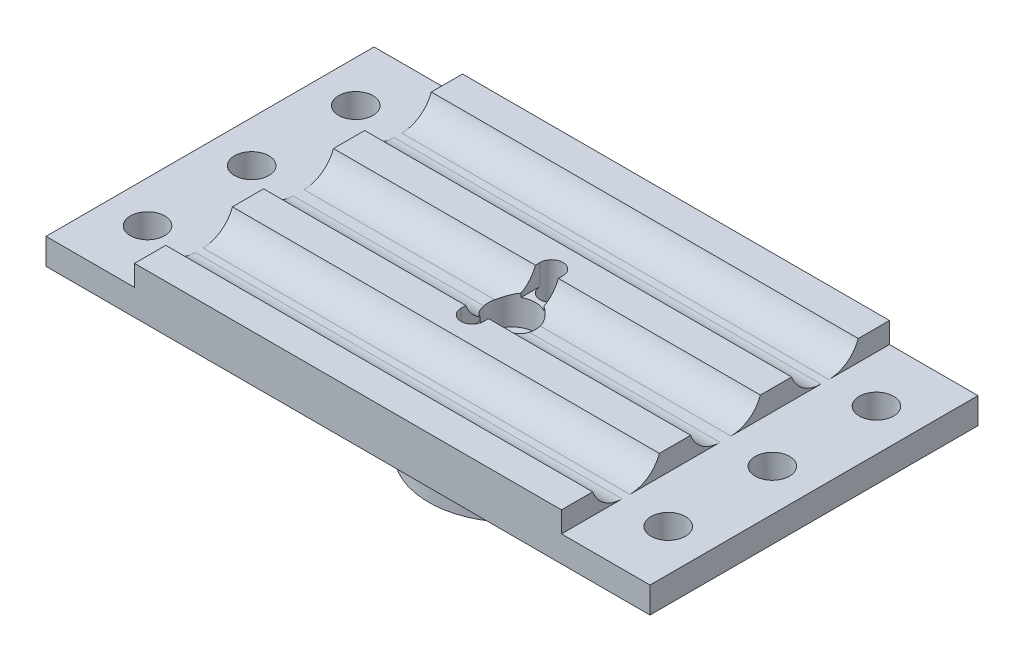
from build123d import *

# Parameters (mm, degrees)
SKETCH_1_R               = 50
EXTRUDE_1_DEPTH          = 2.5
SKETCH_2_R               = 8
EXTRUDE_2_DEPTH          = 9
SKETCH_3_R               = 6.1
CUT_EXTRUDE_1_DEPTH      = 2
CUT_EXTRUDE_2_DEPTH      = 5
SKETCH_7_R               = 1.15
CUT_EXTRUDE_4_DEPTH      = 4.5
SKETCH_8_R               = 2.25
CUT_EXTRUDE_5_DEPTH      = 2.5
CUT_EXTRUDE_6_DEPTH      = 72.281133549
CUT_EXTRUDE_6_DEPTH_BACK = 72.281133549
SKETCH_11_R              = 1.1
SKETCH_14_R              = 1.65
CUT_EXTRUDE_7_DEPTH      = 2.5
CUT_EXTRUDE_START        = -2.5
SKETCH_15_R              = 50
SKETCH_15_W              = 58
SKETCH_15_H              = 31.5
CUT_EXTRUDE_8_DEPTH      = 2.5
SKETCH_16_W              = 41
SKETCH_16_H              = 3
EXTRUDE_4_DEPTH          = 2
CUT_EXTRUDE_9_DEPTH      = 2
FILLET_3_R               = 3


with BuildPart() as part:
    # Эскиз1 → Бобышка-Вытянуть1 (new body)
    with BuildSketch(Plane(origin=(0, 0, 0), x_dir=(1, 0, 0), z_dir=(0, 1, 0))):
        with Locations(Location((0, 0, 0), (0, 0, 270))):
            Circle(SKETCH_1_R)
    extrude(amount=EXTRUDE_1_DEPTH)

    # Эскиз2 → Бобышка-Вытянуть2 (add)
    with BuildSketch(Plane.XZ):
        with Locations(Location((0, 0, 0), (0, 0, 270))):
            Circle(SKETCH_2_R)
    extrude(amount=EXTRUDE_2_DEPTH)

    # Эскиз3 → Вырез-Вытянуть1 (cut)
    with BuildSketch(Plane.XZ.offset(9)):
        with Locations(Location((0, 0, 0), (0, 0, 270))):
            Circle(SKETCH_3_R)
    extrude(amount=-CUT_EXTRUDE_1_DEPTH, mode=Mode.SUBTRACT)

    # Эскиз4 → Вырез-Вытянуть2 (cut)
    with BuildSketch(Plane.XZ.offset(7)):
        with BuildLine():
            Line((-3.1, 5.253570215), (-3.1, -5.253570215))
            ThreePointArc((-3.1, -5.253570215), (0, -6.1), (3.1, -5.253570215))
            Line((3.1, -5.253570215), (3.1, 5.253570215))
            ThreePointArc((3.1, 5.253570215), (0, 6.1), (-3.1, 5.253570215))
        make_face()
    extrude(amount=-CUT_EXTRUDE_2_DEPTH, mode=Mode.SUBTRACT)

    # Эскиз7 → Вырез-Вытянуть4 (cut)
    with BuildSketch(Plane(origin=(0, 2.5, 0), x_dir=(1, 0, 0), z_dir=(0, 1, 0))):
        with Locations(Location((0, 0, 0), (0, 0, 270))):
            Circle(SKETCH_7_R)
    extrude(amount=-CUT_EXTRUDE_4_DEPTH, mode=Mode.SUBTRACT)

    # Эскиз8 → Вырез-Вытянуть5 (cut)
    with BuildSketch(Plane(origin=(0, 2.5, 0), x_dir=(1, 0, 0), z_dir=(0, 1, 0))):
        with Locations(Location((0, 0, 0), (0, 0, 270))):
            Circle(SKETCH_8_R)
    extrude(amount=-CUT_EXTRUDE_5_DEPTH, mode=Mode.SUBTRACT)

    # Эскиз11 → Вырез-Вытянуть6 (cut, two sides: drawn at the far end of the back side and taken through both)
    with BuildSketch(Plane.XZ.offset(-CUT_EXTRUDE_6_DEPTH_BACK)):
        with Locations(Location((0, 3.8, 0), (0, 0, 270))):
            Circle(SKETCH_11_R)
        with Locations(Location((0, -3.8, 0), (0, 0, 90))):
            Circle(SKETCH_11_R)
    extrude(amount=CUT_EXTRUDE_6_DEPTH + CUT_EXTRUDE_6_DEPTH_BACK, mode=Mode.SUBTRACT)

    # Эскиз14 → Вырез-Вытянуть7 (cut)
    with BuildSketch(Plane(origin=(0, 2.5, 0), x_dir=(1, 0, 0), z_dir=(0, 1, 0))):
        with Locations(Location((-25, 0, 0), (0, 0, 270))):
            Circle(SKETCH_14_R)
        with Locations(Location((-25, 10, 0), (0, 0, 270))):
            Circle(SKETCH_14_R)
        with Locations(Location((-25, -10, 0), (0, 0, 270))):
            Circle(SKETCH_14_R)
        with Locations(Location((25, -10, 0), (0, 0, 270))):
            Circle(SKETCH_14_R)
        with Locations(Location((25, 0, 0), (0, 0, 270))):
            Circle(SKETCH_14_R)
        with Locations(Location((25, 10, 0), (0, 0, 270))):
            Circle(SKETCH_14_R)
    extrude(amount=-CUT_EXTRUDE_7_DEPTH, mode=Mode.SUBTRACT)

    # Эскиз15 → Вырез-Вытянуть8 (cut)
    with BuildSketch(Plane(origin=(0, 2.5, 0), x_dir=(1, 0, 0), z_dir=(0, 1, 0)).offset(CUT_EXTRUDE_START)):
        Circle(SKETCH_15_R)
        Rectangle(SKETCH_15_W, SKETCH_15_H, mode=Mode.SUBTRACT)
    extrude(amount=CUT_EXTRUDE_8_DEPTH, mode=Mode.SUBTRACT)

    # Эскиз16 → Бобышка-Вытянуть4 (add)
    with BuildSketch(Plane(origin=(0, 2.5, 0), x_dir=(1, 0, 0), z_dir=(0, 1, 0))):
        with Locations((0, 14.25)):
            Rectangle(SKETCH_16_W, SKETCH_16_H)
        with Locations((0, 4.85)):
            Rectangle(SKETCH_16_W, SKETCH_16_H)
        with Locations((0, -4.85)):
            Rectangle(SKETCH_16_W, SKETCH_16_H)
        with Locations((0, -14.25)):
            Rectangle(SKETCH_16_W, SKETCH_16_H)
    extrude(amount=EXTRUDE_4_DEPTH)

    # Эскиз17 → Вырез-Вытянуть9 (cut)
    with BuildSketch(Plane(origin=(0, 2.5, 0), x_dir=(1, 0, 0), z_dir=(0, 1, 0))):
        with BuildLine():
            Line((-1.1, 3.8), (-1.1, 2.7))
            Line((-1.1, 2.7), (1.1, 2.7))
            Line((1.1, 2.7), (1.1, 3.8))
            ThreePointArc((1.1, 3.8), (0, 4.9), (-1.1, 3.8))
        make_face()
        with BuildLine():
            Line((-1.1, -3.8), (-1.1, -2.7))
            Line((-1.1, -2.7), (1.1, -2.7))
            Line((1.1, -2.7), (1.1, -3.8))
            ThreePointArc((1.1, -3.8), (0, -4.9), (-1.1, -3.8))
        make_face()
    extrude(amount=CUT_EXTRUDE_9_DEPTH, mode=Mode.SUBTRACT)

    # Скругление3
    # the kernel refuses this fillet: 3 mm, written as the material it adds along each edge
    with BuildSketch(Plane(origin=(20.5, 2.5, 12.75), x_dir=(0, 0, -1), z_dir=(-1, 0, 0)), Plane(origin=(-20.5, 2.5, 6.35), x_dir=(0, 0, 1), z_dir=(1, 0, 0))) as fillet_3_piece_1:
        with BuildLine():
            CenterArc((2.828427125, -3), FILLET_3_R, 90, 70.528779366)
            Line((0, -2), (-0.056568542, -1.98))
            ThreePointArc((-0.056568542, -1.98), (-0.06, -1), (-0.06, 0))
            Line((-0.06, 0), (0, 0.06))
            Line((0, 0.06), (2.828427125, 0.06))
            Line((2.828427125, 0.06), (2.828427125, 0))
        make_face()
    extrude(amount=41)
    with BuildSketch(Plane(origin=(20.5, 2.5, 3.35), x_dir=(0, 0, -1), z_dir=(-1, 0, 0))) as fillet_3_piece_2_section:
        with BuildLine():
            CenterArc((2.828427125, -3), FILLET_3_R, 90, 70.528779366)
            Line((0, -2), (-0.056568542, -1.98))
            ThreePointArc((-0.056568542, -1.98), (-0.06, -1), (-0.06, 0))
            Line((-0.06, 0), (0, 0.06))
            Line((0, 0.06), (2.828427125, 0.06))
            Line((2.828427125, 0.06), (2.828427125, 0))
        make_face()
    fillet_3_piece_2 = extrude(amount=19.4, mode=Mode.PRIVATE)
    fillet_3_piece_2 = fillet_3_piece_2 - Plane(origin=(0, 3.015381172, 0), x_dir=(0, 0, 1), z_dir=(0, 1, 0)) * Cylinder(2.25, 51, mode=Mode.PRIVATE)
    add(fillet_3_piece_2)
    with BuildSketch(Plane(origin=(20.5, 2.5, 3.35), x_dir=(0, 0, -1), z_dir=(-1, 0, 0))) as fillet_3_piece_3_section:
        with BuildLine():
            CenterArc((2.828427125, -3), FILLET_3_R, 90, 70.528779366)
            Line((0, -2), (-0.056568542, -1.98))
            ThreePointArc((-0.056568542, -1.98), (-0.06, -1), (-0.06, 0))
            Line((-0.06, 0), (0, 0.06))
            Line((0, 0.06), (2.828427125, 0.06))
            Line((2.828427125, 0.06), (2.828427125, 0))
        make_face()
    fillet_3_piece_3 = extrude(amount=26.471067812, mode=Mode.PRIVATE)
    fillet_3_piece_3 = fillet_3_piece_3 - Plane(origin=(0, 3.020982336, 0), x_dir=(0, 0, 1), z_dir=(0, 1, 0)) * Cylinder(2.25, 65, mode=Mode.PRIVATE)
    fillet_3_piece_3 = split(fillet_3_piece_3, bisect_by=Plane(origin=(-1.1, 3.020982336, 2.69327095), z_dir=(-1, 0, 0)), keep=Keep.TOP, mode=Mode.PRIVATE)
    add(fillet_3_piece_3)
    with BuildSketch(Plane(origin=(5.971067812, 2.5, 3.35), x_dir=(0, 0, -1), z_dir=(-1, 0, 0))) as fillet_3_piece_4_section:
        with BuildLine():
            CenterArc((2.828427125, -3), FILLET_3_R, 90, 70.528779366)
            Line((0, -2), (-0.056568542, -1.98))
            ThreePointArc((-0.056568542, -1.98), (-0.06, -1), (-0.06, 0))
            Line((-0.06, 0), (0, 0.06))
            Line((0, 0.06), (2.828427125, 0.06))
            Line((2.828427125, 0.06), (2.828427125, 0))
        make_face()
    fillet_3_piece_4 = extrude(amount=26.471067812, mode=Mode.PRIVATE)
    fillet_3_piece_4 = fillet_3_piece_4 - Plane(origin=(0, 3.020982326, 0), x_dir=(0, 0, 1), z_dir=(0, 1, 0)) * Cylinder(2.25, 65, mode=Mode.PRIVATE)
    fillet_3_piece_4 = split(fillet_3_piece_4, bisect_by=Plane(origin=(1.1, 3.020982326, 2.69327092), z_dir=(1, 0, 0)), keep=Keep.TOP, mode=Mode.PRIVATE)
    add(fillet_3_piece_4)
    with BuildSketch(Plane(origin=(-1.1, 2.5, 3.35), x_dir=(0, 0, -1), z_dir=(-1, 0, 0))) as fillet_3_piece_5_section:
        with BuildLine():
            CenterArc((2.828427125, -3), FILLET_3_R, 90, 70.528779366)
            Line((0, -2), (-0.056568542, -1.98))
            ThreePointArc((-0.056568542, -1.98), (-0.06, -1), (-0.06, 0))
            Line((-0.06, 0), (0, 0.06))
            Line((0, 0.06), (2.828427125, 0.06))
            Line((2.828427125, 0.06), (2.828427125, 0))
        make_face()
    fillet_3_piece_5 = extrude(amount=19.4, mode=Mode.PRIVATE)
    fillet_3_piece_5 = fillet_3_piece_5 - Plane(origin=(0, 3.015381179, 0), x_dir=(0, 0, 1), z_dir=(0, 1, 0)) * Cylinder(2.25, 51, mode=Mode.PRIVATE)
    add(fillet_3_piece_5)
    with BuildSketch(Plane(origin=(5.971067812, 2.5, -3.35), x_dir=(0, 0, 1), z_dir=(-1, 0, 0))) as fillet_3_piece_6_section:
        with BuildLine():
            CenterArc((2.828427125, 3), FILLET_3_R, 199.471220634, 70.528779366)
            Line((0, 2), (-0.056568542, 1.98))
            ThreePointArc((-0.056568542, 1.98), (-0.06, 1), (-0.06, 0))
            Line((-0.06, 0), (0, -0.06))
            Line((0, -0.06), (2.828427125, -0.06))
            Line((2.828427125, -0.06), (2.828427125, 0))
        make_face()
    fillet_3_piece_6 = extrude(amount=26.471067812, mode=Mode.PRIVATE)
    fillet_3_piece_6 = fillet_3_piece_6 - Plane(origin=(0, 3.020982336, 0), x_dir=(0, 0, 1), z_dir=(0, 1, 0)) * Cylinder(2.25, 65, mode=Mode.PRIVATE)
    fillet_3_piece_6 = split(fillet_3_piece_6, bisect_by=Plane(origin=(1.1, 3.020982336, -2.69327095), z_dir=(1, 0, 0)), keep=Keep.TOP, mode=Mode.PRIVATE)
    add(fillet_3_piece_6)
    with BuildSketch(Plane(origin=(-1.1, 2.5, -3.35), x_dir=(0, 0, 1), z_dir=(-1, 0, 0))) as fillet_3_piece_7_section:
        with BuildLine():
            CenterArc((2.828427125, 3), FILLET_3_R, 199.471220634, 70.528779366)
            Line((0, 2), (-0.056568542, 1.98))
            ThreePointArc((-0.056568542, 1.98), (-0.06, 1), (-0.06, 0))
            Line((-0.06, 0), (0, -0.06))
            Line((0, -0.06), (2.828427125, -0.06))
            Line((2.828427125, -0.06), (2.828427125, 0))
        make_face()
    fillet_3_piece_7 = extrude(amount=19.4, mode=Mode.PRIVATE)
    fillet_3_piece_7 = fillet_3_piece_7 - Plane(origin=(0, 3.015381172, 0), x_dir=(0, 0, 1), z_dir=(0, 1, 0)) * Cylinder(2.25, 51, mode=Mode.PRIVATE)
    add(fillet_3_piece_7)
    with BuildSketch(Plane(origin=(20.5, 2.5, -3.35), x_dir=(0, 0, 1), z_dir=(-1, 0, 0))) as fillet_3_piece_8_section:
        with BuildLine():
            CenterArc((2.828427125, 3), FILLET_3_R, 199.471220634, 70.528779366)
            Line((0, 2), (-0.056568542, 1.98))
            ThreePointArc((-0.056568542, 1.98), (-0.06, 1), (-0.06, 0))
            Line((-0.06, 0), (0, -0.06))
            Line((0, -0.06), (2.828427125, -0.06))
            Line((2.828427125, -0.06), (2.828427125, 0))
        make_face()
    fillet_3_piece_8 = extrude(amount=19.4, mode=Mode.PRIVATE)
    fillet_3_piece_8 = fillet_3_piece_8 - Plane(origin=(0, 3.015381179, 0), x_dir=(0, 0, 1), z_dir=(0, 1, 0)) * Cylinder(2.25, 51, mode=Mode.PRIVATE)
    add(fillet_3_piece_8)
    with BuildSketch(Plane(origin=(20.5, 2.5, -3.35), x_dir=(0, 0, 1), z_dir=(-1, 0, 0))) as fillet_3_piece_9_section:
        with BuildLine():
            CenterArc((2.828427125, 3), FILLET_3_R, 199.471220634, 70.528779366)
            Line((0, 2), (-0.056568542, 1.98))
            ThreePointArc((-0.056568542, 1.98), (-0.06, 1), (-0.06, 0))
            Line((-0.06, 0), (0, -0.06))
            Line((0, -0.06), (2.828427125, -0.06))
            Line((2.828427125, -0.06), (2.828427125, 0))
        make_face()
    fillet_3_piece_9 = extrude(amount=26.471067812, mode=Mode.PRIVATE)
    fillet_3_piece_9 = fillet_3_piece_9 - Plane(origin=(0, 3.020982325, 0), x_dir=(0, 0, 1), z_dir=(0, 1, 0)) * Cylinder(2.25, 65, mode=Mode.PRIVATE)
    fillet_3_piece_9 = split(fillet_3_piece_9, bisect_by=Plane(origin=(-1.1, 3.020982325, -2.69327092), z_dir=(-1, 0, 0)), keep=Keep.TOP, mode=Mode.PRIVATE)
    add(fillet_3_piece_9)
    with BuildSketch(Plane(origin=(-20.5, 2.5, -6.35), x_dir=(0, 0, -1), z_dir=(1, 0, 0)), Plane(origin=(20.5, 2.5, -12.75), x_dir=(0, 0, 1), z_dir=(-1, 0, 0))) as fillet_3_piece_10:
        with BuildLine():
            CenterArc((2.828427125, 3), FILLET_3_R, 199.471220634, 70.528779366)
            Line((0, 2), (-0.056568542, 1.98))
            ThreePointArc((-0.056568542, 1.98), (-0.06, 1), (-0.06, 0))
            Line((-0.06, 0), (0, -0.06))
            Line((0, -0.06), (2.828427125, -0.06))
            Line((2.828427125, -0.06), (2.828427125, 0))
        make_face()
    extrude(amount=41)


solid = part.part
